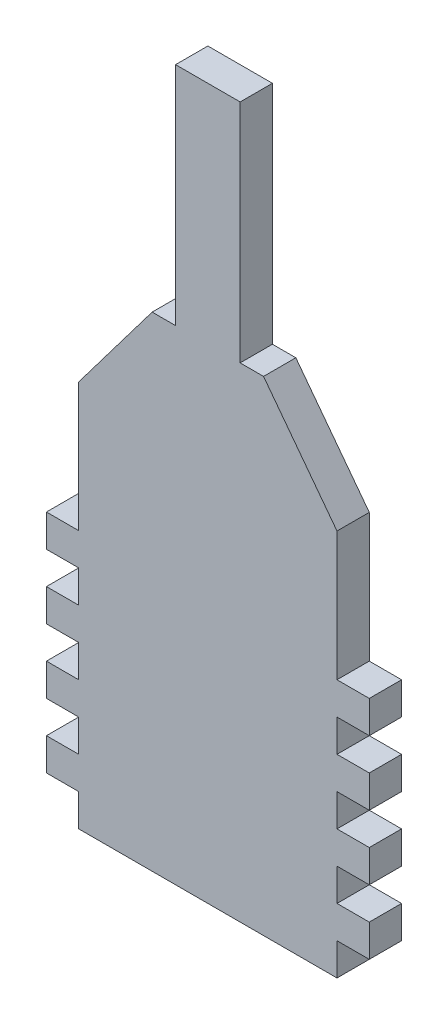
from build123d import *

# Parameters (mm, degrees)
BOSS_EXTRU_1_DEPTH = 5


with BuildPart() as part:
    # Esquisse1 → Boss.-Extru.1 (new body)
    with BuildSketch(Plane.XY):
        Polygon((-88.421426264, 25.834954052), (-88.421426264, 20.834954052), (-48.421426264, 20.834954052), (-48.421426264, 25.834954052), (-43.421426264, 25.834954052), (-43.421426264, 30.834954052), (-48.421426264, 30.834954052), (-48.421426264, 35.834954052), (-43.421426264, 35.834954052), (-43.421426264, 40.834954052), (-48.421426264, 40.834954052), (-48.421426264, 45.834954052), (-43.421426264, 45.834954052), (-43.421426264, 50.834954052), (-48.421426264, 50.834954052), (-48.421426264, 55.834954052), (-43.421426264, 55.834954052), (-43.421426264, 60.834954052), (-48.421426264, 60.834954052), (-48.421426264, 80.785188083), (-59.796426264, 95.834954052), (-63.421426264, 95.834954052), (-63.421426264, 130.834954052), (-73.421426264, 130.834954052), (-73.421426264, 95.834954052), (-77.046426264, 95.834954052), (-88.421426264, 80.785188083), (-88.421426264, 60.834954052), (-93.421426264, 60.834954052), (-93.421426264, 55.834954052), (-88.421426264, 55.834954052), (-88.421426264, 50.834954052), (-93.421426264, 50.834954052), (-93.421426264, 45.834954052), (-88.421426264, 45.834954052), (-88.421426264, 40.834954052), (-93.421426264, 40.834954052), (-93.421426264, 35.834954052), (-88.421426264, 35.834954052), (-88.421426264, 30.834954052), (-93.421426264, 30.834954052), (-93.421426264, 25.834954052), align=None)
    extrude(amount=BOSS_EXTRU_1_DEPTH)


solid = part.part
